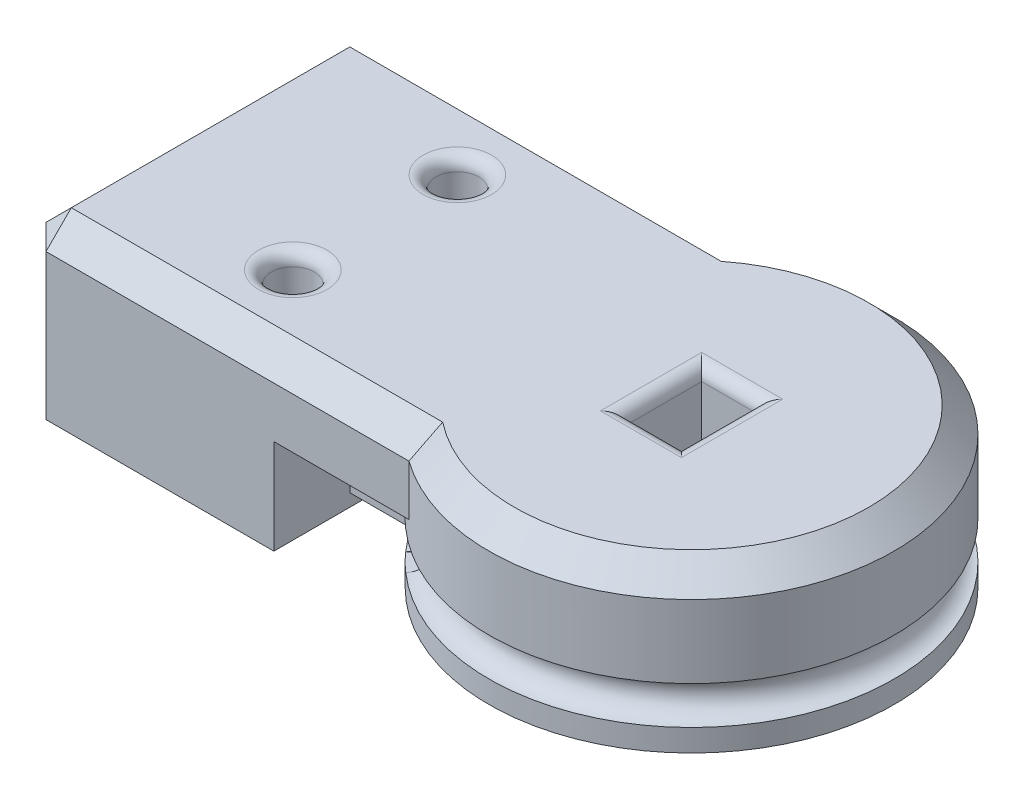
from build123d import *
from build123d.topology import SkipClean

# Parameters (mm, degrees)
SKETCH1_R               = 8
BOSS_EXTRUDE1_DEPTH     = 3.25
SKETCH3_R               = 8
SKETCH3_W               = 2.2
SKETCH3_H               = 3
BOSS_EXTRUDE2_DEPTH     = 3
BOSS_EXTRUDE3_START     = -3
SKETCH4_W               = 10
SKETCH4_H               = 13
BOSS_EXTRUDE3_DEPTH     = 6.75
CUT_EXTRUDE1_DEPTH      = 23.57349109
CUT_EXTRUDE1_DEPTH_BACK = 23.57349109
SKETCH5_R               = 0.85
CUT_EXTRUDE2_DEPTH      = 2.375
CUT_EXTRUDE3_REACH      = 22.768
CUT_EXTRUDE3_END_RADIUS = 0.5
SKETCH7_W               = 1
SKETCH7_H               = 1.5
CUT_EXTRUDE4_REACH      = 22.768
CUT_EXTRUDE4_END_RADIUS = 0.5
SKETCH8_W               = 1
SKETCH8_H               = 1.5
FILLET1_R               = 0.5
CHAMFER1_SIZE           = 1
BOSS_EXTRUDE4_START     = -3.25
BOSS_EXTRUDE4_DEPTH     = 3.25


# Read off the part's stored shape, not the designer's step: Cut-Revolve2
with BuildPart() as part:
    # Sketch1 → Boss-Extrude1 (new body)
    with BuildSketch(Plane(origin=(0, 0, 0), x_dir=(1, 0, 0), z_dir=(0, 1, 0))):
        with Locations(Location((0, 0, 0), (0, 0, 90))):
            Circle(SKETCH1_R)
        Polygon((-1.1, 1.019803903), (-1.1, -1.019803903), (-1.1, -1.5), (1.1, -1.5), (1.1, -1.019803903), (1.1, 1.019803903), (1.1, 1.5), (-1.1, 1.5), align=None, mode=Mode.SUBTRACT)
    extrude(amount=BOSS_EXTRUDE1_DEPTH)

    # Sketch2 → Cut-Revolve1 (revolve, cut)
    with BuildSketch(Plane(origin=(0, 0, 0), x_dir=(0, 0, -1), z_dir=(1, 0, 0))):
        with BuildLine():
            Line((8, 0.875), (8, 2.375))
            ThreePointArc((8, 2.375), (7.25, 1.625), (8, 0.875))
        make_face()
    revolve(axis=Axis((0, 3.25, 0), (0, -1, 0)), mode=Mode.SUBTRACT)

    # Sketch3 → Boss-Extrude2 (add)
    # profile 1 of 2: a face of its own
    with BuildSketch(Plane(origin=(0, 3.25, 0), x_dir=(1, 0, 0), z_dir=(0, 1, 0))):
        with Locations(Location((0, 0, 0), (0, 0, 125.659087696))):
            Circle(SKETCH3_R)
        Rectangle(SKETCH3_W, SKETCH3_H, mode=Mode.SUBTRACT)
    # profile 2 of 2: a face of its own
    with BuildSketch(Plane(origin=(0, 3.25, 0), x_dir=(1, 0, 0), z_dir=(0, 1, 0))):
        with BuildLine():
            Line((-4.663689527, 6.5), (-15, 6.5))
            Line((-15, 6.5), (-15, -6.5))
            Line((-15, -6.5), (-4.663689527, -6.5))
            ThreePointArc((-4.663689527, -6.5), (-8, 0), (-4.663689527, 6.5))
        make_face()
    extrude(amount=BOSS_EXTRUDE2_DEPTH)

    # Sketch4 → Boss-Extrude3 (add)
    with BuildSketch(Plane.XZ.offset(-3.25).offset(BOSS_EXTRUDE3_START)):
        with Locations((-15, 0)):
            Rectangle(SKETCH4_W, SKETCH4_H)
    extrude(amount=BOSS_EXTRUDE3_DEPTH)

    # Sketch5 → Cut-Extrude1 (cut, two sides: drawn at the far end of the back side and taken through both)
    with BuildSketch(Plane(origin=(0, 6.25, 0), x_dir=(1, 0, 0), z_dir=(0, 1, 0)).offset(-CUT_EXTRUDE1_DEPTH_BACK)):
        with Locations(Location((-12.5, 3.25, 0), (0, 0, 180))):
            Circle(SKETCH5_R)
        with Locations(Location((-12.5, -3.25, 0), (0, 0, 180))):
            Circle(SKETCH5_R)
    extrude(amount=CUT_EXTRUDE1_DEPTH + CUT_EXTRUDE1_DEPTH_BACK, mode=Mode.SUBTRACT)

    # Sketch6 → Cut-Extrude2 (cut)
    with BuildSketch(Plane(origin=(0, 0, 0), x_dir=(-1, 0, 0), z_dir=(0, -1, 0))):
        with BuildLine():
            Line((3.5, -4), (3.5, 4))
            ThreePointArc((3.5, 4), (4, 4.5), (4.5, 4))
            Line((4.5, 4), (4.5, 2.704163457))
            ThreePointArc((4.5, 2.704163457), (5.25, 0), (4.5, -2.704163457))
            Line((4.5, -2.704163457), (4.5, -4))
            ThreePointArc((4.5, -4), (4, -4.5), (3.5, -4))
        make_face()
    extrude(amount=-CUT_EXTRUDE2_DEPTH, mode=Mode.SUBTRACT)

    # Cut-Extrude3: up to this cylinder (the profile starts outside it)
    cut_extrude3_end = Plane(origin=(-4, 1.625, 4), z_dir=(0, -1, 0)) * Cylinder(CUT_EXTRUDE3_END_RADIUS, 47.536, mode=Mode.PRIVATE)
    # Sketch7 → Cut-Extrude3 (cut, up to the surface)
    with BuildSketch(Plane(origin=(-5.656854249, 0, 5.656854249), x_dir=(0.707106781186546, 0, 0.7071067811865491), z_dir=(-0.7071067811865491, 0, 0.707106781186546)), mode=Mode.PRIVATE) as cut_extrude3_sk1:
        with Locations((0, 1.625)):
            Rectangle(SKETCH7_W, SKETCH7_H)
    cut_extrude3_tool1 = extrude(cut_extrude3_sk1.sketch, amount=-CUT_EXTRUDE3_REACH, mode=Mode.PRIVATE) - cut_extrude3_end
    add(cut_extrude3_tool1.solids().sort_by_distance((-5.656854, 1.625, 5.656854))[0], mode=Mode.SUBTRACT)

    # Cut-Extrude4: up to this cylinder (the profile starts outside it)
    cut_extrude4_end = Plane(origin=(-4, 1.625, -4), z_dir=(0, -1, 0)) * Cylinder(CUT_EXTRUDE4_END_RADIUS, 47.536, mode=Mode.PRIVATE)
    # Sketch8 → Cut-Extrude4 (cut, up to the surface)
    with BuildSketch(Plane(origin=(-5.656854249, 0, -5.656854249), x_dir=(0.7071067811865457, 0, -0.7071067811865493), z_dir=(0.7071067811865493, 0, 0.7071067811865457)), mode=Mode.PRIVATE) as cut_extrude4_sk1:
        with Locations((0, 1.625)):
            Rectangle(SKETCH8_W, SKETCH8_H)
    cut_extrude4_tool1 = extrude(cut_extrude4_sk1.sketch, amount=CUT_EXTRUDE4_REACH, mode=Mode.PRIVATE) - cut_extrude4_end
    add(cut_extrude4_tool1.solids().sort_by_distance((-5.656854, 1.625, -5.656854))[0], mode=Mode.SUBTRACT)

    # Fillet1
    fillet1_edges = [part.edges().sort_by_distance(p)[0] for p in [
        (1.1, 6.25, 0),
        (0, 6.25, 1.5),
        (-1.1, 6.25, 0),
        (0, 6.25, -1.5),
        (-11.65, 6.25, -3.25),
        (-11.65, -0.5, -3.25),
        (-11.65, 6.25, 3.25),
        (-11.65, -0.5, 3.25),
        (-1.1, 0, 0),
        (0, 0, 1.5),
        (1.1, 0, 0),
        (0, 0, -1.5),
    ]]
    fillet(fillet1_edges, radius=FILLET1_R)

    # Chamfer1
    chamfer1_edges = [part.edges().sort_by_distance(p)[0] for p in [
        (-12.331844763, 6.25, -6.5),
        (8, 6.25, 0),
        (-12.331844763, 6.25, 6.5),
        (-20, 2.875, 6.5),
        (-20, 6.25, 0),
        (-20, 2.875, -6.5),
    ]]
    chamfer(chamfer1_edges, length=CHAMFER1_SIZE)

    # Sketch9 → Boss-Extrude4 (add)
    with BuildSketch(Plane.XZ.offset(BOSS_EXTRUDE4_START)):
        with BuildLine():
            Line((-7.193747285, -3.5), (-10, -3.5))
            Line((-10, -3.5), (-10, 3.5))
            Line((-10, 3.5), (-7.193747285, 3.5))
            ThreePointArc((-7.193747285, 3.5), (-8, 0), (-7.193747285, -3.5))
        make_face()
    extrude(amount=BOSS_EXTRUDE4_DEPTH)

    # Cut-Revolve2 outline → Cut-Revolve2 (revolve, cut)
    with SkipClean():  # the faces are left unmerged after this step: merging them gives an invalid solid
        with BuildSketch(Plane.XY):
            with BuildLine():
                ThreePointArc((8, 0.875), (8.75, 1.625), (8, 2.375))
                Line((8, 2.375), (8, 0.875))
            make_face()
        revolve(axis=Axis((0, 0, 0), (0, 1, 0)), mode=Mode.SUBTRACT)


solid = part.part
